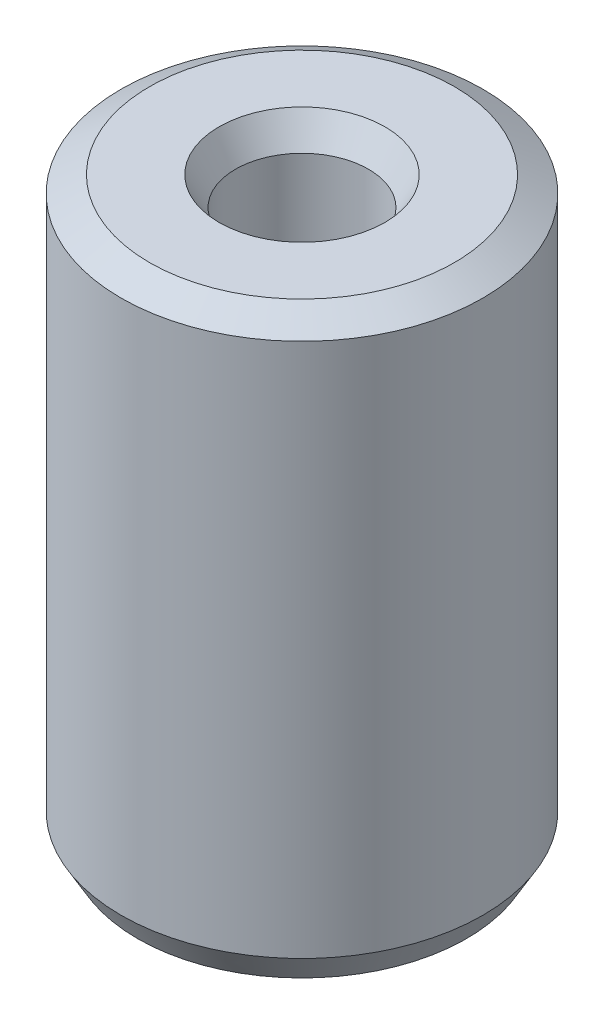
from build123d import *
from OCP.BRepFilletAPI import BRepFilletAPI_MakeChamfer

# Parameters (mm, degrees)
SKETCH1_R           = 20
BOSS_EXTRUDE1_DEPTH = 64.048340346
SKETCH2_R           = 7.347837676
CUT_EXTRUDE1_DEPTH  = 71.015640403
CHAMFER1_SIZE       = 1.818624463
CHAMFER1_SIZE2      = 3.149949971


with BuildPart() as part:
    # Sketch1 → Boss-Extrude1 (new body)
    with BuildSketch(Plane(origin=(0, 0, 0), x_dir=(1, 0, 0), z_dir=(0, 1, 0))):
        Circle(SKETCH1_R)
    extrude(amount=BOSS_EXTRUDE1_DEPTH)

    # Sketch2 → Cut-Extrude1 (cut, through all)
    with BuildSketch(Plane(origin=(0, 0, 0), x_dir=(1, 0, 0), z_dir=(0, 1, 0))):
        Circle(SKETCH2_R)
    extrude(amount=CUT_EXTRUDE1_DEPTH, mode=Mode.SUBTRACT)

    # Chamfer1: one chamfer whose edges measure the first distance from different faces: ONE call of the kernel's chamfer builder (chamfer() names one face for all edges)
    chamfer1_edges_1 = [part.edges().sort_by_distance(p)[0] for p in [
        (-7.347837676, 64.048340346, 0),
    ]]
    chamfer1_side_1 = [part.faces().sort_by_distance(p)[0] for p in [
        (-19.434314575, 64.048340346, 0),
    ]]
    chamfer1_edges_2 = [part.edges().sort_by_distance(p)[0] for p in [
        (-7.347837676, 0, 0),
    ]]
    chamfer1_side_2 = [part.faces().sort_by_distance(p)[0] for p in [
        (-7.347837676, 32.024170173, 0),
    ]]
    chamfer1_edges_3 = [part.edges().sort_by_distance(p)[0] for p in [
        (-20, 0, 0),
    ]]
    chamfer1_side_3 = [part.faces().sort_by_distance(p)[0] for p in [
        (-19.434314575, 0, 0),
    ]]
    chamfer1_edges_4 = [part.edges().sort_by_distance(p)[0] for p in [
        (-20, 64.048340346, 0),
    ]]
    chamfer1_side_4 = [part.faces().sort_by_distance(p)[0] for p in [
        (-20, 32.024170173, 0),
    ]]
    chamfer1 = BRepFilletAPI_MakeChamfer(part.part.solid().wrapped)
    for e in chamfer1_edges_1:
        chamfer1.Add(CHAMFER1_SIZE, CHAMFER1_SIZE2, e.wrapped, chamfer1_side_1[0].wrapped)  # the first distance lies on this face
    for e in chamfer1_edges_2:
        chamfer1.Add(CHAMFER1_SIZE, CHAMFER1_SIZE2, e.wrapped, chamfer1_side_2[0].wrapped)  # the first distance lies on this face
    for e in chamfer1_edges_3:
        chamfer1.Add(CHAMFER1_SIZE, CHAMFER1_SIZE2, e.wrapped, chamfer1_side_3[0].wrapped)  # the first distance lies on this face
    for e in chamfer1_edges_4:
        chamfer1.Add(CHAMFER1_SIZE, CHAMFER1_SIZE2, e.wrapped, chamfer1_side_4[0].wrapped)  # the first distance lies on this face
    add(Compound.cast(chamfer1.Shape()), mode=Mode.REPLACE)


solid = part.part
